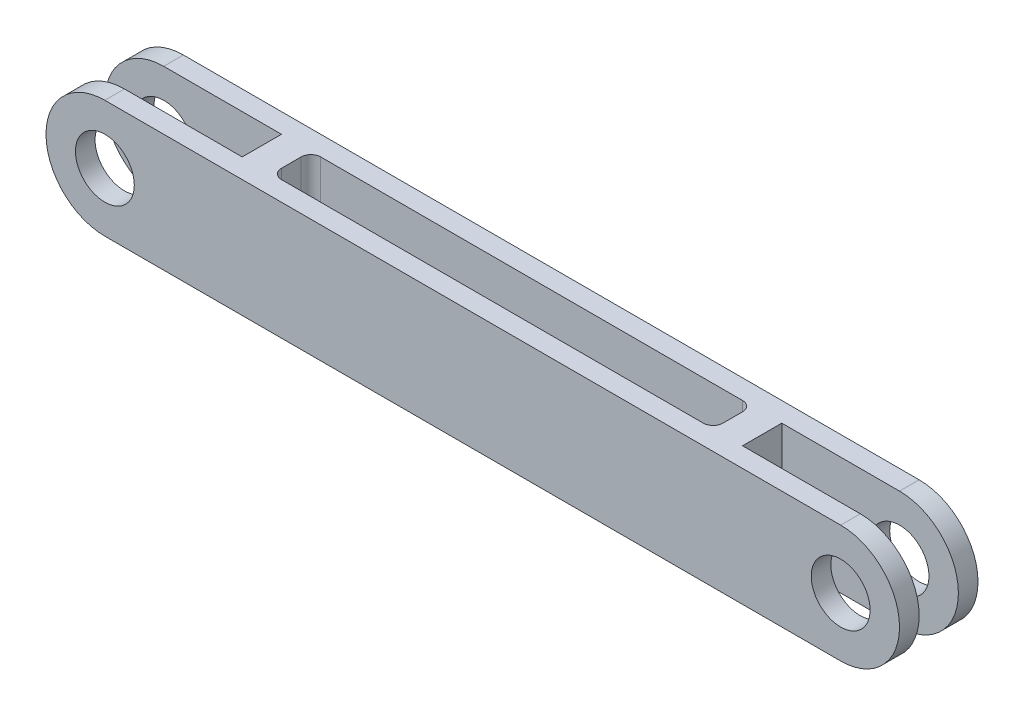
from build123d import *

# Parameters (mm, degrees)
SKETCH_1_R          = 3
EXTRUDE_1_DEPTH     = 8
SKETCH_2_W          = 18
SKETCH_2_H          = 4
CUT_EXTRUDE_1_DEPTH = 46.828484592


with BuildPart() as part:
    # 草图1 → 凸台-拉伸1 (new body)
    with BuildSketch(Plane.XY):
        with BuildLine():
            Line((-37.5, 6), (37.5, 6))
            ThreePointArc((37.5, 6), (43.5, 0), (37.5, -6))
            Line((37.5, -6), (-37.5, -6))
            ThreePointArc((-37.5, -6), (-43.5, 0), (-37.5, 6))
        make_face()
        with Locations((-37.5, 0)):
            Circle(SKETCH_1_R, mode=Mode.SUBTRACT)
        with Locations((37.5, 0)):
            Circle(SKETCH_1_R, mode=Mode.SUBTRACT)
    extrude(amount=EXTRUDE_1_DEPTH)

    # 草图2 → 切除-拉伸1 (cut, through all)
    with BuildSketch(Plane(origin=(0, 6, 0), x_dir=(1, 0, 0), z_dir=(0, 1, 0))):
        with Locations((-34.5, -4)):
            Rectangle(SKETCH_2_W, SKETCH_2_H)
        with Locations((34.5, -4)):
            Rectangle(SKETCH_2_W, SKETCH_2_H)
        with BuildLine():
            Line((-21.5, -6), (21.5, -6))
            ThreePointArc((21.5, -6), (22.207106781, -5.707106781), (22.5, -5))
            Line((22.5, -5), (22.5, -3))
            ThreePointArc((22.5, -3), (22.207106781, -2.292893219), (21.5, -2))
            Line((21.5, -2), (-21.5, -2))
            ThreePointArc((-21.5, -2), (-22.207106781, -2.292893219), (-22.5, -3))
            Line((-22.5, -3), (-22.5, -5))
            ThreePointArc((-22.5, -5), (-22.207106781, -5.707106781), (-21.5, -6))
        make_face()
    extrude(amount=-CUT_EXTRUDE_1_DEPTH, mode=Mode.SUBTRACT)


solid = part.part
